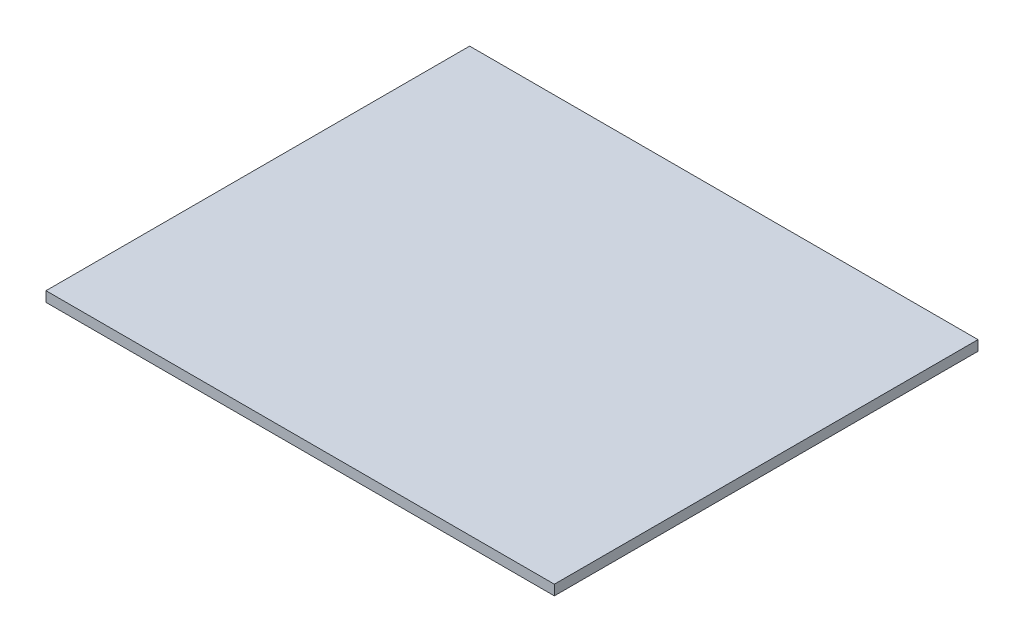
from build123d import *

# Parameters (mm, degrees)
SKETCH1_W           = 914.4
SKETCH1_H           = 762
BOSS_EXTRUDE1_DEPTH = 18.25625


with BuildPart() as part:
    # Sketch1 → Boss-Extrude1 (new body)
    with BuildSketch(Plane(origin=(0, 0, 0), x_dir=(1, 0, 0), z_dir=(0, 1, 0))):
        Rectangle(SKETCH1_W, SKETCH1_H)
    extrude(amount=BOSS_EXTRUDE1_DEPTH)


solid = part.part
